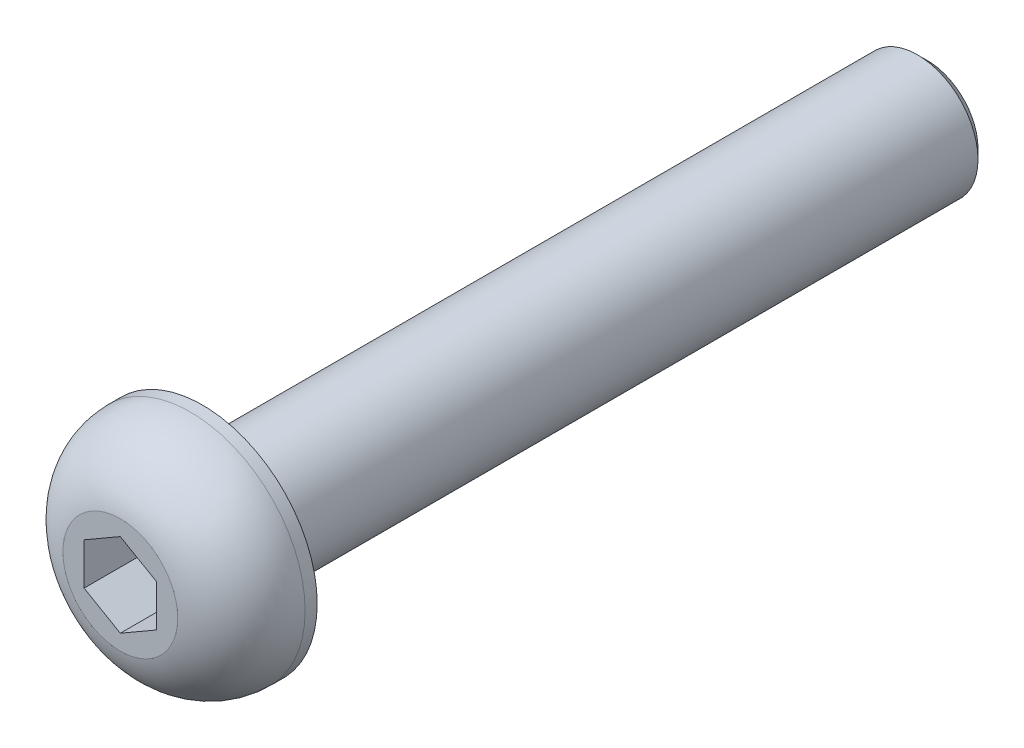
from build123d import *

# Parameters (mm, degrees)
CHAMFER1_SIZE      = 0.4
CUT_EXTRUDE1_START = -2.4000001
CUT_EXTRUDE1_DEPTH = 3.4000001
FILLET1_R          = 0.2


with BuildPart() as part:
    # Sketch1 → Revolve1 (revolve)
    with BuildSketch(Plane(origin=(0, 0, 0), x_dir=(0, 0, -1), z_dir=(1, 0, 0)), mode=Mode.PRIVATE) as revolve1_sk:
        with BuildLine():
            Line((30, 0), (30, 2.5))
            Line((30, 2.5), (0, 2.5))
            Line((0, 2.5), (0, 4.75))
            Line((0, 4.75), (-0.5, 4.75))
            ThreePointArc((-0.5, 4.75), (-2.374208166, 4.080480498), (-3.4, 2.375))
            Line((-3.4, 2.375), (-3.4, 0))
            Line((-3.4, 0), (30, 0))
        make_face()
    revolve(revolve1_sk.sketch.rotate(Axis((0, 0, 30.809969789), (0, 0, -1)), 90), axis=Axis((0, 0, 30.809969789), (0, 0, -1)))

    # Chamfer1
    chamfer1_edges = [part.edges().sort_by_distance(p)[0] for p in [
        (-2.5, 0, -30),
    ]]
    chamfer(chamfer1_edges, length=CHAMFER1_SIZE)

    # Sketch2 → Cut-Revolve1 (revolve, cut)
    with BuildSketch(Plane(origin=(0, 0, 0), x_dir=(0, 0, -1), z_dir=(1, 0, 0)), mode=Mode.PRIVATE) as cut_revolve1_sk:
        Polygon((-3.4, 0), (-3.4, 1.5), (-1, 1.5), (-0.133974596, 0), align=None)
    revolve(cut_revolve1_sk.sketch.rotate(Axis((0, 0, 2.452500839), (0, 0, -1)), 90), axis=Axis((0, 0, 2.452500839), (0, 0, -1)), mode=Mode.SUBTRACT)

    # Cut-Extrude1: read off the stored shape, not the designer's step
    # Cut-Extrude1 outline → Cut-Extrude1 (cut)
    with BuildSketch(Plane.XY.offset(3.4).offset(CUT_EXTRUDE1_START)):
        with BuildLine():
            Line((1.5, 0), (1.5, 0.866025404))
            Line((1.5, 0.866025404), (0.750000011, 1.299038099))
            ThreePointArc((0.750000011, 1.299038099), (1.299038109, 0.749999994), (1.5, 0))
        make_face()
        with BuildLine():
            ThreePointArc((-0.749999993, 1.29903811), (1e-08, 1.5), (0.750000011, 1.299038099))
            Line((0.750000011, 1.299038099), (0, 1.732050808))
            Line((0, 1.732050808), (-0.749999993, 1.29903811))
        make_face()
        with BuildLine():
            Line((1.5, -0.866025404), (1.5, 0))
            ThreePointArc((1.5, 0), (1.299038107, -0.749999997), (0.750000005, -1.299038103))
            Line((0.750000005, -1.299038103), (1.5, -0.866025404))
        make_face()
        with BuildLine():
            ThreePointArc((-1.5, 0), (-1.299038104, 0.750000003), (-0.749999993, 1.29903811))
            Line((-0.749999993, 1.29903811), (-1.5, 0.866025404))
            Line((-1.5, 0.866025404), (-1.5, 0))
        make_face()
        with BuildLine():
            Line((0, -1.732050808), (0.750000005, -1.299038103))
            ThreePointArc((0.750000005, -1.299038103), (3e-09, -1.5), (-0.75, -1.299038106))
            Line((-0.75, -1.299038106), (0, -1.732050808))
        make_face()
        with BuildLine():
            ThreePointArc((-0.75, -1.299038106), (-1.299038106, -0.75), (-1.5, 0))
            Line((-1.5, 0), (-1.5, -0.866025404))
            Line((-1.5, -0.866025404), (-0.75, -1.299038106))
        make_face()
    extrude(amount=CUT_EXTRUDE1_DEPTH, mode=Mode.SUBTRACT)

    # Cut-Extrude1 2 outline → Cut-Extrude1 2 (revolve)
    with BuildSketch(Plane.XZ):
        Polygon((1.732050837, 1.133974613), (1.499999957, 0.999999975), (1.732050808, 0.9999999), align=None)
    revolve(axis=Axis((0, 0, 0), (0, 0, 1)))

    # Fillet1
    fillet1_edges = [part.edges().sort_by_distance(p)[0] for p in [
        (-2.5, 0, 0),
    ]]
    fillet(fillet1_edges, radius=FILLET1_R)


solid = part.part
